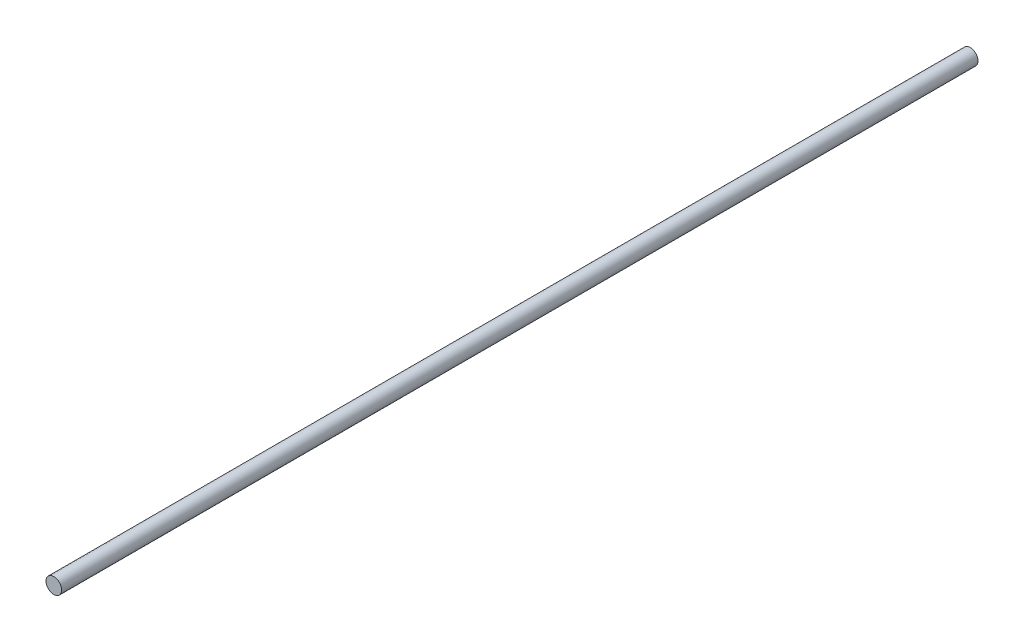
from build123d import *

# Parameters (mm, degrees)
SKETCH1_R           = 2
BOSS_EXTRUDE1_DEPTH = 117.5


with BuildPart() as part:
    # Sketch1 → Boss-Extrude1 (new, symmetric)
    with BuildSketch(Plane.XY):
        Circle(SKETCH1_R)
    extrude(amount=BOSS_EXTRUDE1_DEPTH, both=True)


solid = part.part
